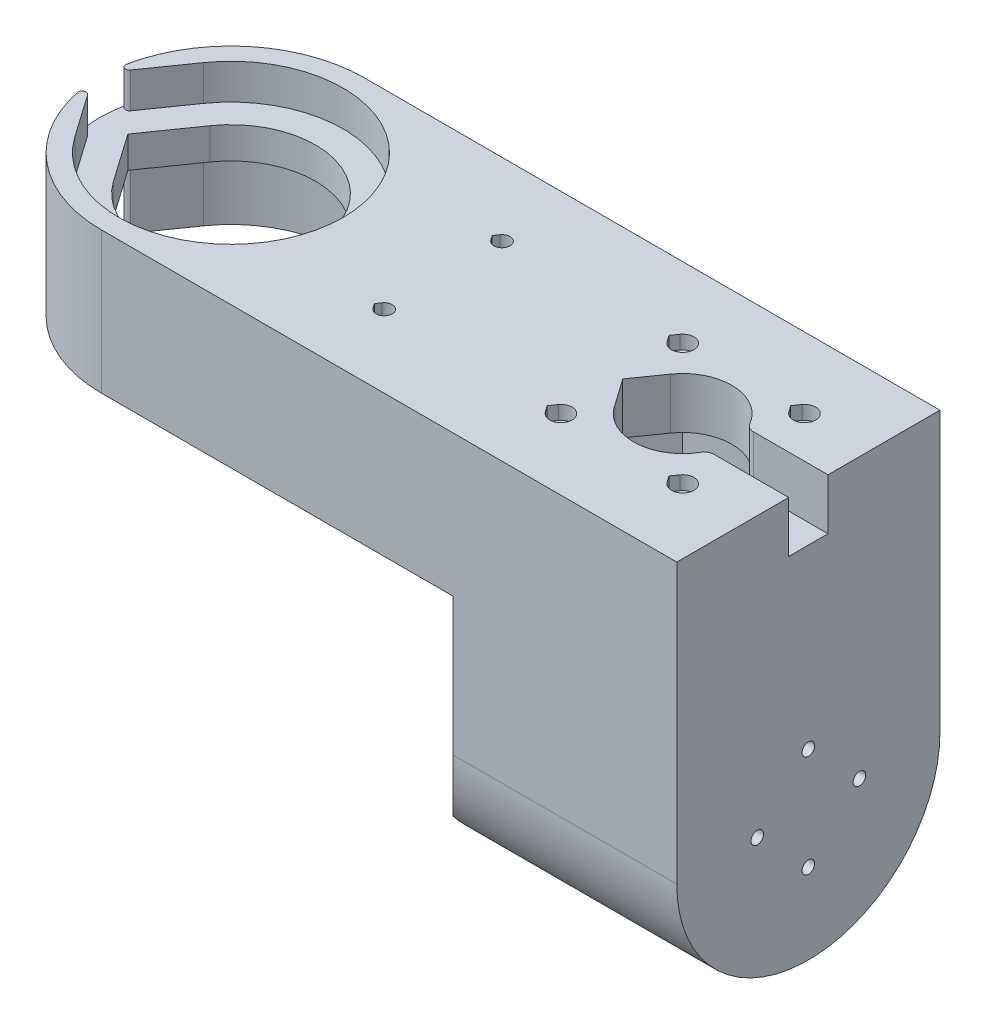
from build123d import *
from OCP.BRepFilletAPI import BRepFilletAPI_MakeChamfer

# Parameters (mm, degrees)
BOSS_EXTRUDE1_DEPTH     = 67
CUT_EXTRUDE1_DEPTH      = 199.010732032
CUT_EXTRUDE1_DEPTH_BACK = 199.010732032
FILLET3_R               = 34
CUT_EXTRUDE2_DEPTH      = 199.010732032
CUT_EXTRUDE2_DEPTH_BACK = 10
CUT_EXTRUDE3_START      = -10
CUT_EXTRUDE3_DEPTH      = 9
CUT_EXTRUDE4_START      = -27
CUT_EXTRUDE4_DEPTH      = 19
CUT_EXTRUDE5_DEPTH      = 13
CUT_EXTRUDE6_DEPTH      = 3.5
CUT_EXTRUDE7_DEPTH      = 10
CUT_EXTRUDE8_DEPTH      = 7
CUT_EXTRUDE18_REACH     = 200.011
CUT_EXTRUDE11_START     = -10
CUT_EXTRUDE11_DEPTH     = 10
CUT_EXTRUDE12_START     = -10
CUT_EXTRUDE12_DEPTH     = 7
CUT_EXTRUDE13_START     = -17
CUT_EXTRUDE13_DEPTH     = 3
FILLET5_R               = 2.5
FILLET1_R               = 5
FILLET2_R               = 2.5
FILLET4_R               = 1
CHAMFER7_SIZE           = 12
CHAMFER5_SIZE           = 9.5
SKETCH11_R              = 1.6
CUT_EXTRUDE19_DEPTH     = 201.29726975
SKETCH11_3_R            = 2.85
CUT_EXTRUDE20_DEPTH     = 3.5
CHAMFER6_SIZE           = 7
CUT_EXTRUDE16_REACH     = 210.875
CHAMFER8_SIZE           = 5
CHAMFER8_SIZE2          = 3.535533906
CUT_EXTRUDE21_START     = -10
CUT_EXTRUDE21_DEPTH     = 10
SKETCH13_R              = 5
CUT_EXTRUDE22_DEPTH     = 10
FILLET6_R               = 5
CUT_EXTRUDE23_START     = -10
CUT_EXTRUDE23_DEPTH     = 10


# Some blends are built 0.0001 mm under size
with BuildPart() as part:
    # Sketch1 → Boss-Extrude1 (new body)
    with BuildSketch(Plane(origin=(0, 0, 0), x_dir=(0, 1, 0), z_dir=(0, 0, 1))):
        Polygon((35, 33.5), (35, -83), (-33.5, -83), (-33.5, -147), (81, -147), (81, 33.5), align=None)
    extrude(amount=BOSS_EXTRUDE1_DEPTH)

    # Sketch2 → Cut-Extrude1 (cut, two sides: drawn at the far end of the back side and taken through both)
    with BuildSketch(Plane(origin=(0, 81, 0), x_dir=(-1, 0, 0), z_dir=(0, 1, 0)).offset(-CUT_EXTRUDE1_DEPTH_BACK)):
        with BuildLine():
            Line((17.611768952, 21.168106618), (26.246653658, 33.5))
            Line((26.246653658, 33.5), (17.611768952, 45.831893382))
            ThreePointArc((17.611768952, 45.831893382), (-21.5, 33.5), (17.611768952, 21.168106618))
        make_face()
    extrude(amount=CUT_EXTRUDE1_DEPTH + CUT_EXTRUDE1_DEPTH_BACK, mode=Mode.SUBTRACT)

    # Fillet3
    # the kernel refuses this fillet: 34 mm, written as the material it takes off along each edge
    with BuildSketch(Plane(origin=(-33.5, 166, 0), x_dir=(0, 0, 1), z_dir=(0, -1, 0))) as fillet3_piece_1:
        with BuildLine():
            CenterArc((FILLET3_R, -FILLET3_R), FILLET3_R, 90, 90)
            Line((0, -FILLET3_R), (0, 0))
            Line((0, 0), (FILLET3_R, 0))
        make_face()
    extrude(amount=216, mode=Mode.SUBTRACT)
    with BuildSketch(Plane(origin=(-33.5, 166, 67), x_dir=(0, 0, -1), z_dir=(0, -1, 0))) as fillet3_piece_2:
        with BuildLine():
            CenterArc((FILLET3_R, FILLET3_R), FILLET3_R, 180, 90)
            Line((0, FILLET3_R), (0, 0))
            Line((0, 0), (FILLET3_R, 0))
        make_face()
    extrude(amount=216, mode=Mode.SUBTRACT)

    # Sketch2<4> → Cut-Extrude2 (cut, two sides: drawn at the far end of the back side and taken through both)
    with BuildSketch(Plane(origin=(0, 81, 0), x_dir=(-1, 0, 0), z_dir=(0, 1, 0)).offset(-CUT_EXTRUDE2_DEPTH_BACK)):
        with BuildLine():
            Line((-147, 16), (-147, 51))
            Line((-147, 51), (-135.082575695, 51))
            ThreePointArc((-135.082575695, 51), (-130.5, 54), (-125.917424305, 51))
            Line((-125.917424305, 51), (-104.082575695, 51))
            ThreePointArc((-104.082575695, 51), (-99.5, 54), (-94.917424305, 51))
            Line((-94.917424305, 51), (-66.071067812, 51))
            ThreePointArc((-66.071067812, 51), (-62.535533906, 52.464466094), (-61.071067812, 56))
            Line((-61.071067812, 56), (-61.071067812, 67))
            Line((-61.071067812, 67), (-21.857492994, 67))
            Line((-21.857492994, 67), (33.5, 67))
            Line((33.5, 67), (33.5, 0))
            Line((33.5, 0), (-21.857492994, 0))
            Line((-21.857492994, 0), (-61.071067812, 0))
            Line((-61.071067812, 0), (-61.071067812, 11))
            ThreePointArc((-61.071067812, 11), (-62.535533906, 14.535533906), (-66.071067812, 16))
            Line((-66.071067812, 16), (-94.917424305, 16))
            ThreePointArc((-94.917424305, 16), (-99.5, 13), (-104.082575695, 16))
            Line((-104.082575695, 16), (-125.917424305, 16))
            ThreePointArc((-125.917424305, 16), (-130.5, 13), (-135.082575695, 16))
            Line((-135.082575695, 16), (-147, 16))
        make_face()
    extrude(amount=CUT_EXTRUDE2_DEPTH + CUT_EXTRUDE2_DEPTH_BACK, mode=Mode.SUBTRACT)

    # Sketch2<5> → Cut-Extrude3 (cut)
    with BuildSketch(Plane(origin=(0, 81, 0), x_dir=(-1, 0, 0), z_dir=(0, 1, 0)).offset(CUT_EXTRUDE3_START)):
        with BuildLine():
            Line((23.386790864, 17.124392742), (34.853114509, 33.5))
            Line((34.853114509, 33.5), (23.386790864, 49.875607258))
            ThreePointArc((23.386790864, 49.875607258), (-28.55, 33.5), (23.386790864, 17.124392742))
        make_face()
    extrude(amount=-CUT_EXTRUDE3_DEPTH, mode=Mode.SUBTRACT)

    # Sketch2<6> → Cut-Extrude4 (cut)
    with BuildSketch(Plane(origin=(0, 81, 0), x_dir=(-1, 0, 0), z_dir=(0, 1, 0)).offset(CUT_EXTRUDE4_START)):
        with BuildLine():
            Line((23.386790864, 17.124392742), (34.853114509, 33.5))
            Line((34.853114509, 33.5), (23.386790864, 49.875607258))
            ThreePointArc((23.386790864, 49.875607258), (-28.55, 33.5), (23.386790864, 17.124392742))
        make_face()
    extrude(amount=-CUT_EXTRUDE4_DEPTH, mode=Mode.SUBTRACT)

    # Sketch3 → Cut-Extrude5 (cut)
    with BuildSketch(Plane(origin=(0, 71, 0), x_dir=(-1, 0, 0), z_dir=(0, 1, 0))):
        with BuildLine():
            Line((-99.74031764, 33.5), (-104.333810411, 40.01785238))
            ThreePointArc((-104.333810411, 40.01785238), (-115.855624093, 45.970681914), (-126.456439237, 38.5))
            Line((-126.456439237, 38.5), (-147, 38.5))
            Line((-147, 38.5), (-147, 28.5))
            Line((-147, 28.5), (-126.456439237, 28.5))
            ThreePointArc((-126.456439237, 28.5), (-116.243865439, 21.062042018), (-104.760599446, 26.330294546))
            Line((-104.760599446, 26.330294546), (-99.74031764, 33.5))
        make_face()
        with BuildLine():
            Line((-129.22, 49.96), (-128.5, 49))
            Line((-128.5, 49), (-129.22, 48.04))
            ThreePointArc((-129.22, 48.04), (-132.1, 49), (-129.22, 49.96))
        make_face()
        with BuildLine():
            Line((-98.22, 48.04), (-97.5, 49))
            Line((-97.5, 49), (-98.22, 49.96))
            ThreePointArc((-98.22, 49.96), (-101.1, 49), (-98.22, 48.04))
        make_face()
        with BuildLine():
            Line((-98.22, 17.04), (-97.5, 18))
            Line((-97.5, 18), (-98.22, 18.96))
            ThreePointArc((-98.22, 18.96), (-101.1, 18), (-98.22, 17.04))
        make_face()
        with BuildLine():
            Line((-129.22, 17.04), (-128.5, 18))
            Line((-128.5, 18), (-129.22, 18.96))
            ThreePointArc((-129.22, 18.96), (-132.1, 18), (-129.22, 17.04))
        make_face()
    extrude(amount=-CUT_EXTRUDE5_DEPTH, mode=Mode.SUBTRACT)

    # Sketch3<3> → Cut-Extrude6 (cut)
    with BuildSketch(Plane(origin=(0, 71, 0), x_dir=(-1, 0, 0), z_dir=(0, 1, 0))):
        with BuildLine():
            Line((-128.179285714, 50.654323186), (-127, 49))
            Line((-127, 49), (-128.179285714, 47.345676814))
            ThreePointArc((-128.179285714, 47.345676814), (-133.35, 49), (-128.179285714, 50.654323186))
        make_face()
        with BuildLine():
            Line((-96, 49), (-97.179285714, 47.345676814))
            ThreePointArc((-97.179285714, 47.345676814), (-102.35, 49), (-97.179285714, 50.654323186))
            Line((-97.179285714, 50.654323186), (-96, 49))
        make_face()
        with BuildLine():
            Line((-96, 18), (-97.179285714, 16.345676814))
            ThreePointArc((-97.179285714, 16.345676814), (-102.35, 18), (-97.179285714, 19.654323186))
            Line((-97.179285714, 19.654323186), (-96, 18))
        make_face()
        with BuildLine():
            Line((-127, 18), (-128.179285714, 16.345676814))
            ThreePointArc((-128.179285714, 16.345676814), (-133.35, 18), (-128.179285714, 19.654323186))
            Line((-128.179285714, 19.654323186), (-127, 18))
        make_face()
    extrude(amount=-CUT_EXTRUDE6_DEPTH, mode=Mode.SUBTRACT)

    # Sketch4 → Cut-Extrude7 (cut)
    with BuildSketch(Plane(origin=(0, 71, 0), x_dir=(-1, 0, 0), z_dir=(0, 1, 0))):
        with BuildLine():
            Line((-52.689356729, 49.417722298), (-52.046760658, 48.5))
            Line((-52.046760658, 48.5), (-52.689356729, 47.582277702))
            ThreePointArc((-52.689356729, 47.582277702), (-55.6, 48.5), (-52.689356729, 49.417722298))
        make_face()
        with BuildLine():
            Line((-52.689356729, 19.417722298), (-52.046760658, 18.5))
            Line((-52.046760658, 18.5), (-52.689356729, 17.582277702))
            ThreePointArc((-52.689356729, 17.582277702), (-55.6, 18.5), (-52.689356729, 19.417722298))
        make_face()
    extrude(amount=-CUT_EXTRUDE7_DEPTH, mode=Mode.SUBTRACT)

    # Sketch4<3> → Cut-Extrude8 (cut)
    # profile 1 of 2: a face of its own
    with BuildSketch(Plane(origin=(0, 71, 0), x_dir=(-1, 0, 0), z_dir=(0, 1, 0))):
        with BuildLine():
            Line((-51.497412093, 48.5), (-52.320738309, 47.324168305))
            ThreePointArc((-52.320738309, 47.324168305), (-56.05, 48.5), (-52.320738309, 49.675831695))
            Line((-52.320738309, 49.675831695), (-51.497412093, 48.5))
        make_face()
        with BuildLine():
            Line((-52.689356729, 49.417722298), (-52.046760658, 48.5))
            Line((-52.046760658, 48.5), (-52.689356729, 47.582277702))
            ThreePointArc((-52.689356729, 47.582277702), (-55.6, 48.5), (-52.689356729, 49.417722298))
        make_face(mode=Mode.SUBTRACT)
    # profile 2 of 2: a face of its own
    with BuildSketch(Plane(origin=(0, 71, 0), x_dir=(-1, 0, 0), z_dir=(0, 1, 0))):
        with BuildLine():
            Line((-51.497412093, 18.5), (-52.320738309, 17.324168305))
            ThreePointArc((-52.320738309, 17.324168305), (-56.05, 18.5), (-52.320738309, 19.675831695))
            Line((-52.320738309, 19.675831695), (-51.497412093, 18.5))
        make_face()
        with BuildLine():
            Line((-52.689356729, 19.417722298), (-52.046760658, 18.5))
            Line((-52.046760658, 18.5), (-52.689356729, 17.582277702))
            ThreePointArc((-52.689356729, 17.582277702), (-55.6, 18.5), (-52.689356729, 19.417722298))
        make_face(mode=Mode.SUBTRACT)
    extrude(amount=-CUT_EXTRUDE8_DEPTH, mode=Mode.SUBTRACT)

    # Cut-Extrude18: up to this face of the body (flat: up to its plane)
    cut_extrude18_end = Plane(part.part.faces().sort_by_distance((120.971111033, 58, 33.49934117))[0])
    # Sketch10 → Cut-Extrude18 (cut, up to the picked face)
    with BuildSketch(Plane.XZ.offset(33.5), mode=Mode.PRIVATE) as cut_extrude18_sk1:
        Polygon((93, 55.5), (137, 55.5), (137, 11.5), (93, 11.5), (93, 23.5), (83, 23.5), (83, 43.5), (93, 43.5), align=None)
    cut_extrude18_tool1 = split(extrude(cut_extrude18_sk1.sketch, amount=-CUT_EXTRUDE18_REACH, mode=Mode.PRIVATE), bisect_by=cut_extrude18_end, keep=Keep.BOTH, mode=Mode.PRIVATE)
    add(cut_extrude18_tool1.solids().sort_by(Axis((112.47191, -33.5, 33.5), (0, 1, 0)))[0], mode=Mode.SUBTRACT)

    # Sketch6 → Cut-Extrude11 (cut)
    with BuildSketch(Plane.XZ.offset(-35).offset(CUT_EXTRUDE11_START)):
        with BuildLine():
            Line((91.1, 36), (91.1, 31))
            Line((91.1, 31), (69.431732852, 31))
            Line((69.431732852, 31), (59.431732852, 23.5))
            Line((59.431732852, 23.5), (54.431732852, 23.5))
            Line((54.431732852, 23.5), (54.431732852, 11.134248627))
            Line((54.431732852, 11.134248627), (39.431732852, 11.134248627))
            Line((39.431732852, 11.134248627), (17.744736277, 11.134248627))
            ThreePointArc((17.744736277, 11.134248627), (28.383056062, 30.417042236), (22.132970349, 51.534248627))
            Line((22.132970349, 51.534248627), (39.431732852, 51.534248627))
            Line((39.431732852, 51.534248627), (54.431732852, 51.534248627))
            Line((54.431732852, 51.534248627), (54.431732852, 43.5))
            Line((54.431732852, 43.5), (59.431732852, 43.5))
            Line((59.431732852, 43.5), (69.431732852, 36))
            Line((69.431732852, 36), (91.1, 36))
        make_face()
    extrude(amount=CUT_EXTRUDE11_DEPTH, mode=Mode.SUBTRACT)

    # Sketch6<4> → Cut-Extrude12 (cut)
    with BuildSketch(Plane.XZ.offset(-35).offset(CUT_EXTRUDE12_START)):
        with BuildLine():
            Line((36.929144946, 16.334248627), (37.752471162, 17.510080322))
            ThreePointArc((37.752471162, 17.510080322), (41.481732852, 16.334248627), (37.752471162, 15.158416933))
            Line((37.752471162, 15.158416933), (36.929144946, 16.334248627))
        make_face()
        with BuildLine():
            Line((36.929144946, 46.334248627), (37.752471162, 47.510080322))
            ThreePointArc((37.752471162, 47.510080322), (41.481732852, 46.334248627), (37.752471162, 45.158416933))
            Line((37.752471162, 45.158416933), (36.929144946, 46.334248627))
        make_face()
    extrude(amount=-CUT_EXTRUDE12_DEPTH, mode=Mode.SUBTRACT)

    # Sketch6<5> → Cut-Extrude13 (cut)
    with BuildSketch(Plane.XZ.offset(-35).offset(CUT_EXTRUDE13_START)):
        with BuildLine():
            Line((38.121089582, 15.416526329), (37.47849351, 16.334248627))
            Line((37.47849351, 16.334248627), (38.121089582, 17.251970925))
            ThreePointArc((38.121089582, 17.251970925), (41.031732852, 16.334248627), (38.121089582, 15.416526329))
        make_face()
        with BuildLine():
            Line((38.121089582, 45.416526329), (37.47849351, 46.334248627))
            Line((37.47849351, 46.334248627), (38.121089582, 47.251970925))
            ThreePointArc((38.121089582, 47.251970925), (41.031732852, 46.334248627), (38.121089582, 45.416526329))
        make_face()
    extrude(amount=-CUT_EXTRUDE13_DEPTH, mode=Mode.SUBTRACT)

    # Fillet5
    fillet5_edges = [part.edges().sort_by_distance(p)[0] for p in [
        (69.431732852, 40, 36),
        (54.431732852, 40, 23.5),
        (54.431732852, 40, 43.5),
        (59.431732852, 40, 43.5),
        (69.431732852, 40, 31),
        (59.431732852, 40, 23.5),
    ]]
    fillet(fillet5_edges, radius=FILLET5_R)

    # Fillet1
    fillet1_edges = [part.edges().sort_by_distance(p)[0] for p in [
        (61.071067812, 76, 0),
        (61.071067812, 76, 67),
    ]]
    fillet(fillet1_edges, radius=FILLET1_R)

    # Fillet2
    fillet2_edges = [part.edges().sort_by_distance(p)[0] for p in [
        (126.456439237, 64.5, 38.5),
        (126.456439237, 64.5, 28.5),
        (135.082575695, 76, 16),
        (135.082575695, 76, 51),
        (125.917424305, 76, 51),
        (104.082575695, 76, 51),
        (94.917424305, 76, 51),
        (94.917424305, 76, 16),
        (104.082575695, 76, 16),
        (125.917424305, 76, 16),
    ]]
    fillet(fillet2_edges, radius=FILLET2_R)

    # Fillet4
    fillet4_edges = [part.edges().sort_by_distance(p)[0] for p in [
        (-33.402614008, 66.5, 35.5715294),
        (-33.402614008, 66.5, 31.4284706),
        (-33.402614008, 44.5, 35.5715294),
        (-33.402614008, 44.5, 31.4284706),
    ]]
    fillet(fillet4_edges, radius=FILLET4_R)

    # Chamfer7
    # the kernel refuses this chamfer: 12 mm, written as the material it takes off along each edge
    with BuildSketch(Plane(origin=(93, -64.360195856, 43.5), x_dir=(0.02749587661058678, 0, 0.9996219169112968), z_dir=(0, 1, 0))) as chamfer7_piece_1_section:
        Polygon((CHAMFER7_SIZE * 0.999621916911, -CHAMFER7_SIZE * 0.0274958766106), (-CHAMFER7_SIZE * 0.0274958766106, -CHAMFER7_SIZE * 0.999621916911), (0, 0), align=None)
    chamfer7_piece_1 = extrude(amount=122.360195856, mode=Mode.PRIVATE)
    chamfer7_piece_1 = split(chamfer7_piece_1, bisect_by=Plane(origin=(83, 0.75, 52.5), z_dir=(1, 0, 0)), keep=Keep.TOP, mode=Mode.PRIVATE)
    add(chamfer7_piece_1, mode=Mode.SUBTRACT)
    with BuildSketch(Plane(origin=(93, -64.360195856, 23.5), x_dir=(-0.9996219169112965, 0, 0.02749587661058705), z_dir=(0, 1, 0))) as chamfer7_piece_2_section:
        Polygon((CHAMFER7_SIZE * 0.999621916911, -CHAMFER7_SIZE * 0.0274958766106), (-CHAMFER7_SIZE * 0.0274958766106, -CHAMFER7_SIZE * 0.999621916911), (0, 0), align=None)
    chamfer7_piece_2 = extrude(amount=122.360195856, mode=Mode.PRIVATE)
    chamfer7_piece_2 = split(chamfer7_piece_2, bisect_by=Plane(origin=(83, 0.75, 20.234168406), z_dir=(1, 0, 0)), keep=Keep.TOP, mode=Mode.PRIVATE)
    add(chamfer7_piece_2, mode=Mode.SUBTRACT)

    # Chamfer5
    chamfer5_edges = [part.edges().sort_by_distance(p)[0] for p in [
        (83, 40, 36),
        (83, 40, 31),
    ]]
    chamfer(chamfer5_edges, length=CHAMFER5_SIZE - 0.0001)  # a hair under: the kernel refuses the full size

    # Sketch11 → Cut-Extrude19 (cut, through all)
    with BuildSketch(Plane(origin=(137, 0, 0), x_dir=(0, -1, 0), z_dir=(-1, 0, 0))):
        with Locations((0, 46.5)):
            Circle(SKETCH11_R)
        with Locations((13, 33.5)):
            Circle(SKETCH11_R)
        with Locations((0, 20.5)):
            Circle(SKETCH11_R)
        with Locations((-13, 33.5)):
            Circle(SKETCH11_R)
    extrude(amount=-CUT_EXTRUDE19_DEPTH, mode=Mode.SUBTRACT)

    # Sketch11<3> → Cut-Extrude20 (cut)
    with BuildSketch(Plane(origin=(137, 0, 0), x_dir=(0, -1, 0), z_dir=(-1, 0, 0))):
        with Locations((0, 46.5)):
            Circle(SKETCH11_3_R)
        with Locations((13, 33.5)):
            Circle(SKETCH11_3_R)
        with Locations((0, 20.5)):
            Circle(SKETCH11_3_R)
        with Locations((-13, 33.5)):
            Circle(SKETCH11_3_R)
    extrude(amount=-CUT_EXTRUDE20_DEPTH, mode=Mode.SUBTRACT)

    # Chamfer6
    chamfer6_edges = [part.edges().sort_by_distance(p)[0] for p in [
        (83, 0.75, 0),
        (83, 0.75, 67),
    ]]
    chamfer(chamfer6_edges, length=CHAMFER6_SIZE)

    # Cut-Extrude16: up to this face of the body (flat: up to its plane)
    cut_extrude16_end = Plane(part.part.faces().sort_by_distance((83, 0.75, 52.75))[0])
    # Sketch9 → Cut-Extrude16 (cut, up to the picked face)
    with BuildSketch(Plane.YZ.offset(147), mode=Mode.PRIVATE) as cut_extrude16_sk1:
        with BuildLine():
            Line((0, 67), (-54.532381669, 67))
            Line((-54.532381669, 67), (-54.532381669, 0))
            Line((-54.532381669, 0), (0, 0))
            ThreePointArc((0, 0), (-33.5, 33.5), (0, 67))
        make_face()
    cut_extrude16_tool1 = split(extrude(cut_extrude16_sk1.sketch, amount=-CUT_EXTRUDE16_REACH, mode=Mode.PRIVATE), bisect_by=cut_extrude16_end, keep=Keep.BOTH, mode=Mode.PRIVATE)
    add(cut_extrude16_tool1.solids().sort_by(Axis((147, -39.431118, 33.5), (-1, 0, 0)))[0], mode=Mode.SUBTRACT)

    # Chamfer8: one chamfer whose edges measure the first distance from different faces: ONE call of the kernel's chamfer builder (chamfer() names one face for all edges)
    chamfer8_edges_1 = [part.edges().sort_by_distance(p)[0] for p in [
        (83, 1.861505827, 45.5),
    ]]
    chamfer8_side_1 = [part.faces().sort_by_distance(p)[0] for p in [
        (87.942666778, 14.648131718, 50.442666778),
    ]]
    chamfer8_edges_2 = [part.edges().sort_by_distance(p)[0] for p in [
        (83, 1.861505827, 21.5),
    ]]
    chamfer8_side_2 = [part.faces().sort_by_distance(p)[0] for p in [
        (87.942666778, 14.648131718, 16.557333222),
    ]]
    chamfer8 = BRepFilletAPI_MakeChamfer(part.part.solid().wrapped)
    for e in chamfer8_edges_1:
        chamfer8.Add(CHAMFER8_SIZE, CHAMFER8_SIZE2, e.wrapped, chamfer8_side_1[0].wrapped)  # the first distance lies on this face
    for e in chamfer8_edges_2:
        chamfer8.Add(CHAMFER8_SIZE, CHAMFER8_SIZE2, e.wrapped, chamfer8_side_2[0].wrapped)  # the first distance lies on this face
    add(Compound.cast(chamfer8.Shape()), mode=Mode.REPLACE)

    # Sketch12 → Cut-Extrude21 (cut)
    with BuildSketch(Plane(origin=(83, 0, 0), x_dir=(0, -1, 0), z_dir=(-1, 0, 0)).offset(CUT_EXTRUDE21_START)):
        with BuildLine():
            Line((25.263610193, 55.5), (25.263610193, 11.5))
            ThreePointArc((25.263610193, 11.5), (33.5, 33.5), (25.263610193, 55.5))
        make_face()
    extrude(amount=CUT_EXTRUDE21_DEPTH, mode=Mode.SUBTRACT)

    # Sketch13 → Cut-Extrude22 (cut)
    with BuildSketch(Plane(origin=(83, 0, 0), x_dir=(0, -1, 0), z_dir=(-1, 0, 0))):
        with Locations((0, 46.5)):
            Circle(SKETCH13_R)
        with Locations((0, 20.5)):
            Circle(SKETCH13_R)
    extrude(amount=-CUT_EXTRUDE22_DEPTH, mode=Mode.SUBTRACT)

    # Fillet6
    fillet6_edges = [part.edges().sort_by_distance(p)[0] for p in [
        (84.767766953, -4.30941618, 17.964466094),
        (84.767766953, 4.30941618, 17.964466094),
        (84.767766953, 4.30941618, 49.035533906),
        (84.767766953, -4.30941618, 49.035533906),
    ]]
    fillet(fillet6_edges, radius=FILLET6_R)

    # Sketch14 → Cut-Extrude23 (cut)
    with BuildSketch(Plane(origin=(0, 81, 0), x_dir=(-1, 0, 0), z_dir=(0, 1, 0)).offset(CUT_EXTRUDE23_START)):
        with BuildLine():
            Line((-66.071067812, 16), (-93.5, 16))
            ThreePointArc((-93.5, 16), (-94.618033989, 15.736067977), (-95.5, 15))
            ThreePointArc((-95.5, 15), (-99.5, 13), (-103.5, 15))
            ThreePointArc((-103.5, 15), (-104.381966011, 15.736067977), (-105.5, 16))
            Line((-105.5, 16), (-124.5, 16))
            ThreePointArc((-124.5, 16), (-125.618033989, 15.736067977), (-126.5, 15))
            ThreePointArc((-126.5, 15), (-130.5, 13), (-134.5, 15))
            ThreePointArc((-134.5, 15), (-135.381966011, 15.736067977), (-136.5, 16))
            Line((-136.5, 16), (-147, 16))
            Line((-147, 16), (-147, 0))
            Line((-147, 0), (-66.071067812, 0))
            ThreePointArc((-66.071067812, 0), (-62.535533906, 1.464466094), (-61.071067812, 5))
            Line((-61.071067812, 5), (-61.071067812, 11))
            ThreePointArc((-61.071067812, 11), (-62.535533906, 14.535533906), (-66.071067812, 16))
        make_face()
        with BuildLine():
            Line((-93.5, 51), (-66.071067812, 51))
            ThreePointArc((-66.071067812, 51), (-62.535533906, 52.464466094), (-61.071067812, 56))
            Line((-61.071067812, 56), (-61.071067812, 62))
            ThreePointArc((-61.071067812, 62), (-62.535533906, 65.535533906), (-66.071067812, 67))
            Line((-66.071067812, 67), (-147, 67))
            Line((-147, 67), (-147, 51))
            Line((-147, 51), (-136.5, 51))
            ThreePointArc((-136.5, 51), (-135.381966011, 51.263932023), (-134.5, 52))
            ThreePointArc((-134.5, 52), (-130.5, 54), (-126.5, 52))
            ThreePointArc((-126.5, 52), (-125.618033989, 51.263932023), (-124.5, 51))
            Line((-124.5, 51), (-105.5, 51))
            ThreePointArc((-105.5, 51), (-104.381966011, 51.263932023), (-103.5, 52))
            ThreePointArc((-103.5, 52), (-99.5, 54), (-95.5, 52))
            ThreePointArc((-95.5, 52), (-94.618033989, 51.263932023), (-93.5, 51))
        make_face()
    extrude(amount=CUT_EXTRUDE23_DEPTH, mode=Mode.SUBTRACT)


solid = part.part
